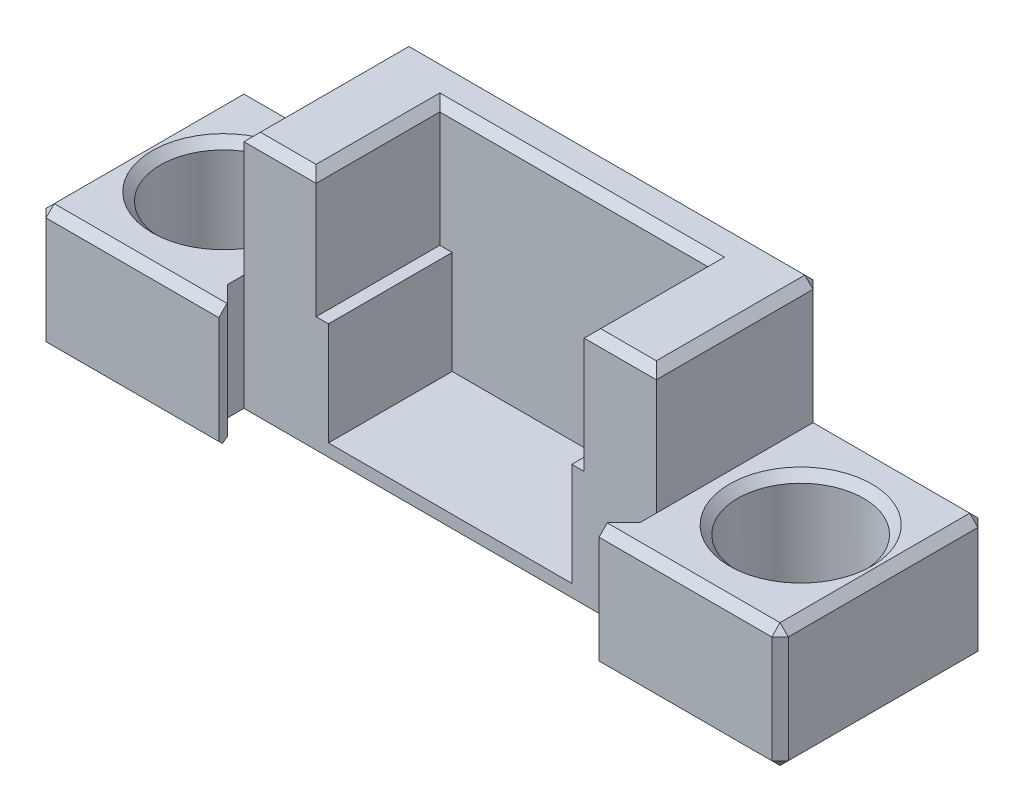
from build123d import *

# Parameters (mm, degrees)
SKETCH1_W           = 20
SKETCH1_H           = 10
BOSS_EXTRUDE1_DEPTH = 12
SKETCH2_W           = 36
SKETCH2_H           = 10
BOSS_EXTRUDE2_DEPTH = 6
SKETCH3_R           = 3.05
CUT_EXTRUDE1_DEPTH  = 20.62141687
SKETCH4_W           = 13
SKETCH4_H           = 6
CUT_EXTRUDE2_DEPTH  = 6
SKETCH5_W           = 20
SKETCH5_H           = 12
CUT_EXTRUDE3_DEPTH  = 2
SKETCH6_W           = 11.8
SKETCH6_H           = 6
CUT_EXTRUDE4_DEPTH  = 5
BOSS_EXTRUDE3_DEPTH = 6


with BuildPart() as part:
    # Sketch1 → Boss-Extrude1 (new body)
    with BuildSketch(Plane(origin=(0, 0, 0), x_dir=(1, 0, 0), z_dir=(0, 1, 0))):
        Rectangle(SKETCH1_W, SKETCH1_H)
    extrude(amount=BOSS_EXTRUDE1_DEPTH)

    # Sketch2 → Boss-Extrude2 (add)
    with BuildSketch(Plane.XZ):
        Rectangle(SKETCH2_W, SKETCH2_H)
    extrude(amount=-BOSS_EXTRUDE2_DEPTH)

    # Sketch3 → Cut-Extrude1 (cut, through all)
    with BuildSketch(Plane(origin=(0, 6, 0), x_dir=(1, 0, 0), z_dir=(0, 1, 0))):
        with Locations(Location((-14, 0, 0), (0, 0, 270))):
            Circle(SKETCH3_R)
        with Locations(Location((14, 0, 0), (0, 0, 270))):
            Circle(SKETCH3_R)
    extrude(amount=-CUT_EXTRUDE1_DEPTH, mode=Mode.SUBTRACT)

    # Sketch4 → Cut-Extrude2 (cut)
    with BuildSketch(Plane(origin=(0, 12, 0), x_dir=(1, 0, 0), z_dir=(0, 1, 0))):
        Rectangle(SKETCH4_W, SKETCH4_H)
    extrude(amount=-CUT_EXTRUDE2_DEPTH, mode=Mode.SUBTRACT)

    # Sketch5 → Cut-Extrude3 (cut)
    with BuildSketch(Plane.XY.offset(5)):
        with Locations((0, 6)):
            Rectangle(SKETCH5_W, SKETCH5_H)
    extrude(amount=-CUT_EXTRUDE3_DEPTH, mode=Mode.SUBTRACT)

    # Sketch6 → Cut-Extrude4 (cut)
    with BuildSketch(Plane(origin=(0, 6, 0), x_dir=(1, 0, 0), z_dir=(0, 1, 0))):
        Rectangle(SKETCH6_W, SKETCH6_H)
    extrude(amount=-CUT_EXTRUDE4_DEPTH, mode=Mode.SUBTRACT)

    # Sketch7 → Boss-Extrude3 (add)
    with BuildSketch(Plane(origin=(0, 6, 0), x_dir=(1, 0, 0), z_dir=(0, 1, 0))):
        Polygon((-10, -5), (-9.22, -5), (-9.22, -4.58), (-10, -3.8), align=None)
        Polygon((10, -3.8), (10, -5), (9.22, -5), (9.22, -4.58), align=None)
    extrude(amount=-BOSS_EXTRUDE3_DEPTH)

    # Chamfer1
    # the kernel refuses this chamfer: 0.4 mm, written as the material it takes off along each edge
    with BuildSketch(Plane(origin=(17.733333333, 5.733333333, 4.733333333), x_dir=(0.7071067811865491, 0, -0.7071067811865459), z_dir=(0.5773502691896257, 0.5773502691896232, 0.5773502691896283)), Plane(origin=(17.733333333, 5.733333333, -4.733333333), x_dir=(-0.7071067811865444, 0, -0.7071067811865506), z_dir=(0.5773502691896283, 0.5773502691896257, -0.5773502691896232)), Plane(origin=(-17.733333333, 0.266666667, 4.733333333), x_dir=(-0.707106781186546, 0, -0.7071067811865491), z_dir=(-0.5773502691896272, -0.5773502691896252, 0.5773502691896248))) as chamfer1_piece_1:
        Polygon((-0.282842712, -0.163299316), (0.282842712, -0.163299316), (0, 0.326598632), align=None)
    extrude(amount=0.508068237, mode=Mode.SUBTRACT)
    with BuildSketch(Plane(origin=(17.733333333, 0.266666667, 4.733333333), x_dir=(-6.2803698347350965e-15, 0.7071067811865472, 0.7071067811865478), z_dir=(0.5773502691896255, -0.5773502691896235, 0.5773502691896282)), Plane(origin=(17.733333333, 0.266666667, -4.733333333), x_dir=(0.7071067811865462, 0.7071067811865488, 0), z_dir=(0.5773502691896282, -0.5773502691896261, -0.5773502691896231)), Plane(origin=(-17.733333333, 0.266666667, -4.733333333), x_dir=(0.7071067811865462, -0.7071067811865488, 0), z_dir=(-0.5773502691896264, -0.5773502691896244, -0.5773502691896264)), Plane(origin=(-17.733333333, 5.733333333, 4.733333333), x_dir=(0, -0.7071067811865475, 0.7071067811865475), z_dir=(-0.5773502691896275, 0.577350269189625, 0.577350269189625)), Plane(origin=(-17.733333333, 5.733333333, -4.733333333), x_dir=(-0.707106781186546, -0.7071067811865491, 0), z_dir=(-0.5773502691896266, 0.577350269189624, -0.5773502691896266)), Plane(origin=(-9.733333333, 11.733333333, -4.733333333), x_dir=(-0.7071067811865475, -0.7071067811865475, 0), z_dir=(-0.577350269189625, 0.577350269189625, -0.5773502691896275)), Plane(origin=(9.733333333, 11.733333333, -4.733333333), x_dir=(0, -0.7071067811865475, -0.7071067811865475), z_dir=(0.5773502691896257, 0.5773502691896257, -0.5773502691896257))) as chamfer1_piece_2:
        Polygon((-0.282842712, 0.163299316), (0.282842712, 0.163299316), (0, -0.326598632), align=None)
    extrude(amount=0.508068237, mode=Mode.SUBTRACT)
    with BuildSketch(Plane(origin=(14, 0, 0), x_dir=(0, 0, 1), z_dir=(-1, 0, 0))) as chamfer1_piece_3:
        with BuildLine():
            Line((3.038686292, 0.411313708), (3.461313708, -0.011313708))
            Line((3.461313708, -0.011313708), (3.461313708, -0.019313708))
            ThreePointArc((3.461313708, -0.019313708), (3.255656854, -0.008), (3.05, -0.008))
            Line((3.05, -0.008), (3.042, 0))
            ThreePointArc((3.042, 0), (3.042, 0.205656854), (3.030686292, 0.411313708))
            Line((3.030686292, 0.411313708), (3.038686292, 0.411313708))
        make_face()
    revolve(axis=Axis((14, 0, 0), (0, 1, 0)), mode=Mode.SUBTRACT)
    with BuildSketch(Plane(origin=(14, 6, 0), x_dir=(0, 0, 1), z_dir=(-1, 0, 0))) as chamfer1_piece_4:
        with BuildLine():
            Line((3.461313708, 0.011313708), (3.038686292, -0.411313708))
            Line((3.038686292, -0.411313708), (3.030686292, -0.411313708))
            ThreePointArc((3.030686292, -0.411313708), (3.042, -0.205656854), (3.042, 0))
            Line((3.042, 0), (3.05, 0.008))
            ThreePointArc((3.05, 0.008), (3.255656854, 0.008), (3.461313708, 0.019313708))
            Line((3.461313708, 0.019313708), (3.461313708, 0.011313708))
        make_face()
    revolve(axis=Axis((14, 6, 0), (0, 1, 0)), mode=Mode.SUBTRACT)
    with BuildSketch(Plane(origin=(-14, 0, 0), x_dir=(0, 0, 1), z_dir=(-1, 0, 0))) as chamfer1_piece_5:
        with BuildLine():
            Line((3.038686292, 0.411313708), (3.461313708, -0.011313708))
            Line((3.461313708, -0.011313708), (3.461313708, -0.019313708))
            ThreePointArc((3.461313708, -0.019313708), (3.255656854, -0.008), (3.05, -0.008))
            Line((3.05, -0.008), (3.042, 0))
            ThreePointArc((3.042, 0), (3.042, 0.205656854), (3.030686292, 0.411313708))
            Line((3.030686292, 0.411313708), (3.038686292, 0.411313708))
        make_face()
    revolve(axis=Axis((-14, 0, 0), (0, 1, 0)), mode=Mode.SUBTRACT)
    with BuildSketch(Plane(origin=(-14, 6, 0), x_dir=(0, 0, 1), z_dir=(-1, 0, 0))) as chamfer1_piece_6:
        with BuildLine():
            Line((3.461313708, 0.011313708), (3.038686292, -0.411313708))
            Line((3.038686292, -0.411313708), (3.030686292, -0.411313708))
            ThreePointArc((3.030686292, -0.411313708), (3.042, -0.205656854), (3.042, 0))
            Line((3.042, 0), (3.05, 0.008))
            ThreePointArc((3.05, 0.008), (3.255656854, 0.008), (3.461313708, 0.019313708))
            Line((3.461313708, 0.019313708), (3.461313708, 0.011313708))
        make_face()
    revolve(axis=Axis((-14, 6, 0), (0, 1, 0)), mode=Mode.SUBTRACT)
    with BuildSketch(Plane(origin=(10, 0, 3), x_dir=(0, 0.9996219169112968, 0.02749587661058625), z_dir=(-1, 0, 0))) as chamfer1_piece_7:
        with BuildLine():
            Line((0.411469278, 0), (-0.022618862, 0.410847117))
            Line((-0.022618862, 0.410847117), (-0.030615837, 0.41062715))
            ThreePointArc((-0.030615837, 0.41062715), (-0.013651691, 0.205359132), (-0.007996975, -0.000219967))
            Line((-0.007996975, -0.000219967), (0.000219967, -0.007996975))
            ThreePointArc((0.000219967, -0.007996975), (0.205799066, -0.00234226), (0.411689245, -0.007996975))
            Line((0.411689245, -0.007996975), (0.411469278, 0))
        make_face()
    extrude(amount=20, mode=Mode.SUBTRACT)
    with BuildSketch(Plane(origin=(10, 0, 4.828673195), x_dir=(-0.027495876610587326, 0.9996219169112966, 0), z_dir=(0, 0, -1))) as chamfer1_piece_8_section:
        with BuildLine():
            Line((0.411469278, 0), (-0.022618862, 0.410847117))
            Line((-0.022618862, 0.410847117), (-0.030615837, 0.41062715))
            ThreePointArc((-0.030615837, 0.41062715), (-0.013651691, 0.205359132), (-0.007996975, -0.000219967))
            Line((-0.007996975, -0.000219967), (0.000219967, -0.007996975))
            ThreePointArc((0.000219967, -0.007996975), (0.205799066, -0.00234226), (0.411689245, -0.007996975))
            Line((0.411689245, -0.007996975), (0.411469278, 0))
        make_face()
    chamfer1_piece_8 = extrude(amount=1.828673195, mode=Mode.PRIVATE)
    chamfer1_piece_8 = split(chamfer1_piece_8, bisect_by=Plane(origin=(10.287531855, 0.140047879, 3.512468145), z_dir=(-0.7071067811865437, 0, -0.7071067811865513)), keep=Keep.TOP, mode=Mode.PRIVATE)
    add(chamfer1_piece_8, mode=Mode.SUBTRACT)
    with BuildSketch(Plane(origin=(8.492618208, 0, 5.307381792), x_dir=(-0.019442520806013025, 0.9996219169112968, -0.019442520806013233), z_dir=(0.7071067811865513, 0, -0.7071067811865437))) as chamfer1_piece_9_section:
        with BuildLine():
            Line((0.411469278, 0), (-0.022618862, 0.410847117))
            Line((-0.022618862, 0.410847117), (-0.030615837, 0.41062715))
            ThreePointArc((-0.030615837, 0.41062715), (-0.013651691, 0.205359132), (-0.007996975, -0.000219967))
            Line((-0.007996975, -0.000219967), (0.000219967, -0.007996975))
            ThreePointArc((0.000219967, -0.007996975), (0.205799066, -0.00234226), (0.411689245, -0.007996975))
            Line((0.411689245, -0.007996975), (0.411469278, 0))
        make_face()
    chamfer1_piece_9 = extrude(amount=3.160432969, mode=Mode.PRIVATE)
    chamfer1_piece_9 = split(chamfer1_piece_9, bisect_by=Plane(origin=(10, 0.134633563, 4.688221688), z_dir=(-1, 0, 0)), keep=Keep.TOP, mode=Mode.PRIVATE)
    add(chamfer1_piece_9, mode=Mode.SUBTRACT)
    with BuildSketch(Plane(origin=(19.028673195, 6, 5), x_dir=(0, 0.027495876610587302, -0.9996219169112966), z_dir=(-1, 0, 0)), Plane(origin=(19.028673195, 0, 5), x_dir=(0, 0.9996219169112966, 0.02749587661058735), z_dir=(-1, 0, 0))) as chamfer1_piece_10:
        with BuildLine():
            Line((0.411469278, 0), (-0.022618862, 0.410847117))
            Line((-0.022618862, 0.410847117), (-0.030615837, 0.41062715))
            ThreePointArc((-0.030615837, 0.41062715), (-0.013651691, 0.205359132), (-0.007996975, -0.000219967))
            Line((-0.007996975, -0.000219967), (0.000219967, -0.007996975))
            ThreePointArc((0.000219967, -0.007996975), (0.205799066, -0.00234226), (0.411689245, -0.007996975))
            Line((0.411689245, -0.007996975), (0.411469278, 0))
        make_face()
    extrude(amount=10.83734639, mode=Mode.SUBTRACT)
    with BuildSketch(Plane(origin=(18, 0, -6.028673195), x_dir=(0.02749587661058735, 0.9996219169112966, 0), z_dir=(0, 0, 1)), Plane(origin=(18, 6, -6.028673195), x_dir=(-0.9996219169112966, 0.02749587661058742, 0), z_dir=(0, 0, 1)), Plane(origin=(-18, 0, 6.028673195), x_dir=(-0.02749587661058735, 0.9996219169112966, 0), z_dir=(0, 0, -1)), Plane(origin=(-18, 6, 6.028673195), x_dir=(0.9996219169112966, 0.02749587661058742, 0), z_dir=(0, 0, -1))) as chamfer1_piece_11:
        with BuildLine():
            Line((0.411469278, 0), (-0.022618862, 0.410847117))
            Line((-0.022618862, 0.410847117), (-0.030615837, 0.41062715))
            ThreePointArc((-0.030615837, 0.41062715), (-0.013651691, 0.205359132), (-0.007996975, -0.000219967))
            Line((-0.007996975, -0.000219967), (0.000219967, -0.007996975))
            ThreePointArc((0.000219967, -0.007996975), (0.205799066, -0.00234226), (0.411689245, -0.007996975))
            Line((0.411689245, -0.007996975), (0.411469278, 0))
        make_face()
    extrude(amount=12.05734639, mode=Mode.SUBTRACT)
    with BuildSketch(Plane(origin=(-19.028673195, 0, -5), x_dir=(0, 0.9996219169112966, -0.02749587661058735), z_dir=(1, 0, 0))) as chamfer1_piece_12:
        with BuildLine():
            Line((0.411469278, 0), (-0.022618862, 0.410847117))
            Line((-0.022618862, 0.410847117), (-0.030615837, 0.41062715))
            ThreePointArc((-0.030615837, 0.41062715), (-0.013651691, 0.205359132), (-0.007996975, -0.000219967))
            Line((-0.007996975, -0.000219967), (0.000219967, -0.007996975))
            ThreePointArc((0.000219967, -0.007996975), (0.205799066, -0.00234226), (0.411689245, -0.007996975))
            Line((0.411689245, -0.007996975), (0.411469278, 0))
        make_face()
    extrude(amount=38.05734639, mode=Mode.SUBTRACT)
    with BuildSketch(Plane(origin=(-19.028673195, 0, 5), x_dir=(0, 0.9996219169112966, 0.02749587661058735), z_dir=(1, 0, 0)), Plane(origin=(-8.191326805, 6, 5), x_dir=(0, -0.9996219169112966, 0.027495876610587302), z_dir=(-1, 0, 0))) as chamfer1_piece_13:
        with BuildLine():
            Line((0.411469278, 0), (-0.022618862, -0.410847117))
            Line((-0.022618862, -0.410847117), (-0.030615837, -0.41062715))
            ThreePointArc((-0.030615837, -0.41062715), (-0.013651691, -0.205359132), (-0.007996975, 0.000219967))
            Line((-0.007996975, 0.000219967), (0.000219967, 0.007996975))
            ThreePointArc((0.000219967, 0.007996975), (0.205799066, 0.00234226), (0.411689245, 0.007996975))
            Line((0.411689245, 0.007996975), (0.411469278, 0))
        make_face()
    extrude(amount=10.83734639, mode=Mode.SUBTRACT)
    with BuildSketch(Plane(origin=(-8.492618208, 0, 5.307381792), x_dir=(0.019442520806011977, 0.9996219169112968, -0.019442520806012123), z_dir=(-0.7071067811865501, 0, -0.7071067811865449))) as chamfer1_piece_14_section:
        with BuildLine():
            Line((0.411469278, 0), (-0.022618862, -0.410847117))
            Line((-0.022618862, -0.410847117), (-0.030615837, -0.41062715))
            ThreePointArc((-0.030615837, -0.41062715), (-0.013651691, -0.205359132), (-0.007996975, 0.000219967))
            Line((-0.007996975, 0.000219967), (0.000219967, 0.007996975))
            ThreePointArc((0.000219967, 0.007996975), (0.205799066, 0.00234226), (0.411689245, 0.007996975))
            Line((0.411689245, 0.007996975), (0.411469278, 0))
        make_face()
    chamfer1_piece_14 = extrude(amount=3.160432969, mode=Mode.PRIVATE)
    chamfer1_piece_14 = split(chamfer1_piece_14, bisect_by=Plane(origin=(-10, 0.134633563, 4.688221688), z_dir=(1, 0, 0)), keep=Keep.TOP, mode=Mode.PRIVATE)
    add(chamfer1_piece_14, mode=Mode.SUBTRACT)
    with BuildSketch(Plane(origin=(-10, 0, 4.828673195), x_dir=(0.02749587661058735, 0.9996219169112966, 0), z_dir=(0, 0, -1))) as chamfer1_piece_15_section:
        with BuildLine():
            Line((0.411469278, 0), (-0.022618862, -0.410847117))
            Line((-0.022618862, -0.410847117), (-0.030615837, -0.41062715))
            ThreePointArc((-0.030615837, -0.41062715), (-0.013651691, -0.205359132), (-0.007996975, 0.000219967))
            Line((-0.007996975, 0.000219967), (0.000219967, 0.007996975))
            ThreePointArc((0.000219967, 0.007996975), (0.205799066, 0.00234226), (0.411689245, 0.007996975))
            Line((0.411689245, 0.007996975), (0.411469278, 0))
        make_face()
    chamfer1_piece_15 = extrude(amount=1.828673195, mode=Mode.PRIVATE)
    chamfer1_piece_15 = split(chamfer1_piece_15, bisect_by=Plane(origin=(-10.287531855, 0.140047879, 3.512468145), z_dir=(0.7071067811865449, 0, -0.7071067811865501)), keep=Keep.TOP, mode=Mode.PRIVATE)
    add(chamfer1_piece_15, mode=Mode.SUBTRACT)
    with BuildSketch(Plane(origin=(6.5, 12, 4.028673195), x_dir=(-0.027495876610587302, -0.9996219169112966, 0), z_dir=(0, 0, -1)), Plane(origin=(-6.5, 12, -3), x_dir=(0.027495876610587302, -0.9996219169112966, 0), z_dir=(0, 0, 1))) as chamfer1_piece_16:
        with BuildLine():
            Line((0.411469278, 0), (-0.022618862, -0.410847117))
            Line((-0.022618862, -0.410847117), (-0.030615837, -0.41062715))
            ThreePointArc((-0.030615837, -0.41062715), (-0.013651691, -0.205359132), (-0.007996975, 0.000219967))
            Line((-0.007996975, 0.000219967), (0.000219967, 0.007996975))
            ThreePointArc((0.000219967, 0.007996975), (0.205799066, 0.00234226), (0.411689245, 0.007996975))
            Line((0.411689245, 0.007996975), (0.411469278, 0))
        make_face()
    extrude(amount=7.028673195, mode=Mode.SUBTRACT)
    with BuildSketch(Plane(origin=(6.5, 12, -3), x_dir=(0, -0.9996219169112968, 0.027495876610586226), z_dir=(-1, 0, 0))) as chamfer1_piece_17:
        with BuildLine():
            Line((0.411469278, 0), (-0.022618862, -0.410847117))
            Line((-0.022618862, -0.410847117), (-0.030615837, -0.41062715))
            ThreePointArc((-0.030615837, -0.41062715), (-0.013651691, -0.205359132), (-0.007996975, 0.000219967))
            Line((-0.007996975, 0.000219967), (0.000219967, 0.007996975))
            ThreePointArc((0.000219967, 0.007996975), (0.205799066, 0.00234226), (0.411689245, 0.007996975))
            Line((0.411689245, 0.007996975), (0.411469278, 0))
        make_face()
    extrude(amount=13, mode=Mode.SUBTRACT)
    with BuildSketch(Plane(origin=(-11.028673195, 12, 3), x_dir=(0, -0.9996219169112968, 0.027495876610586226), z_dir=(1, 0, 0)), Plane(origin=(5.471326805, 12, 3), x_dir=(0, -0.9996219169112968, 0.027495876610586226), z_dir=(1, 0, 0))) as chamfer1_piece_18:
        with BuildLine():
            Line((0.411469278, 0), (-0.022618862, 0.410847117))
            Line((-0.022618862, 0.410847117), (-0.030615837, 0.41062715))
            ThreePointArc((-0.030615837, 0.41062715), (-0.013651691, 0.205359132), (-0.007996975, -0.000219967))
            Line((-0.007996975, -0.000219967), (0.000219967, -0.007996975))
            ThreePointArc((0.000219967, -0.007996975), (0.205799066, -0.00234226), (0.411689245, -0.007996975))
            Line((0.411689245, -0.007996975), (0.411469278, 0))
        make_face()
    extrude(amount=5.55734639, mode=Mode.SUBTRACT)
    with BuildSketch(Plane(origin=(-10, 12, -6.028673195), x_dir=(-0.027495876610587302, -0.9996219169112966, 0), z_dir=(0, 0, 1))) as chamfer1_piece_19:
        with BuildLine():
            Line((0.411469278, 0), (-0.022618862, 0.410847117))
            Line((-0.022618862, 0.410847117), (-0.030615837, 0.41062715))
            ThreePointArc((-0.030615837, 0.41062715), (-0.013651691, 0.205359132), (-0.007996975, -0.000219967))
            Line((-0.007996975, -0.000219967), (0.000219967, -0.007996975))
            ThreePointArc((0.000219967, -0.007996975), (0.205799066, -0.00234226), (0.411689245, -0.007996975))
            Line((0.411689245, -0.007996975), (0.411469278, 0))
        make_face()
    extrude(amount=10.05734639, mode=Mode.SUBTRACT)
    with BuildSketch(Plane(origin=(11.028673195, 12, -5), x_dir=(0, -0.9996219169112966, -0.027495876610587302), z_dir=(-1, 0, 0))) as chamfer1_piece_20:
        with BuildLine():
            Line((0.411469278, 0), (-0.022618862, 0.410847117))
            Line((-0.022618862, 0.410847117), (-0.030615837, 0.41062715))
            ThreePointArc((-0.030615837, 0.41062715), (-0.013651691, 0.205359132), (-0.007996975, -0.000219967))
            Line((-0.007996975, -0.000219967), (0.000219967, -0.007996975))
            ThreePointArc((0.000219967, -0.007996975), (0.205799066, -0.00234226), (0.411689245, -0.007996975))
            Line((0.411689245, -0.007996975), (0.411469278, 0))
        make_face()
    extrude(amount=22.05734639, mode=Mode.SUBTRACT)
    with BuildSketch(Plane(origin=(10, 12, 4.028673195), x_dir=(-0.9996219169112966, 0.027495876610587302, 0), z_dir=(0, 0, -1))) as chamfer1_piece_21:
        with BuildLine():
            Line((0.411469278, 0), (-0.022618862, -0.410847117))
            Line((-0.022618862, -0.410847117), (-0.030615837, -0.41062715))
            ThreePointArc((-0.030615837, -0.41062715), (-0.013651691, -0.205359132), (-0.007996975, 0.000219967))
            Line((-0.007996975, 0.000219967), (0.000219967, 0.007996975))
            ThreePointArc((0.000219967, 0.007996975), (0.205799066, 0.00234226), (0.411689245, 0.007996975))
            Line((0.411689245, 0.007996975), (0.411469278, 0))
        make_face()
    extrude(amount=10.05734639, mode=Mode.SUBTRACT)
    with BuildSketch(Plane(origin=(10, 6, -5), x_dir=(-0.9996219169112966, 0, -0.027495876610587302), z_dir=(0, 1, 0)), Plane(origin=(-10, 6, -5), x_dir=(-0.027495876610587302, 0, 0.9996219169112966), z_dir=(0, 1, 0))) as chamfer1_piece_22:
        with BuildLine():
            Line((0.411469278, 0), (-0.022618862, 0.410847117))
            Line((-0.022618862, 0.410847117), (-0.030615837, 0.41062715))
            ThreePointArc((-0.030615837, 0.41062715), (-0.013651691, 0.205359132), (-0.007996975, -0.000219967))
            Line((-0.007996975, -0.000219967), (0.000219967, -0.007996975))
            ThreePointArc((0.000219967, -0.007996975), (0.205799066, -0.00234226), (0.411689245, -0.007996975))
            Line((0.411689245, -0.007996975), (0.411469278, 0))
        make_face()
    extrude(amount=7.028673195, mode=Mode.SUBTRACT)
    with BuildSketch(Plane(origin=(10, 6, -5), x_dir=(0, -0.9996219169112966, -0.027495876610591618), z_dir=(1, 0, 0)), Plane(origin=(-19.028673195, 6, -5), x_dir=(0, -0.9996219169112966, -0.027495876610587302), z_dir=(1, 0, 0))) as chamfer1_piece_23:
        with BuildLine():
            Line((0.411469278, 0), (-0.022618862, -0.410847117))
            Line((-0.022618862, -0.410847117), (-0.030615837, -0.41062715))
            ThreePointArc((-0.030615837, -0.41062715), (-0.013651691, -0.205359132), (-0.007996975, 0.000219967))
            Line((-0.007996975, 0.000219967), (0.000219967, 0.007996975))
            ThreePointArc((0.000219967, 0.007996975), (0.205799066, 0.00234226), (0.411689245, 0.007996975))
            Line((0.411689245, 0.007996975), (0.411469278, 0))
        make_face()
    extrude(amount=9.028673195, mode=Mode.SUBTRACT)
    with BuildSketch(Plane(origin=(18, -1.028673195, 5), x_dir=(-0.9996219169112966, 0, 0.02749587661058742), z_dir=(0, 1, 0)), Plane(origin=(-18, -1.028673195, -5), x_dir=(0.9996219169112966, 0, -0.02749587661058742), z_dir=(0, 1, 0))) as chamfer1_piece_24:
        with BuildLine():
            Line((0.411469278, 0), (-0.022618862, -0.410847117))
            Line((-0.022618862, -0.410847117), (-0.030615837, -0.41062715))
            ThreePointArc((-0.030615837, -0.41062715), (-0.013651691, -0.205359132), (-0.007996975, 0.000219967))
            Line((-0.007996975, 0.000219967), (0.000219967, 0.007996975))
            ThreePointArc((0.000219967, 0.007996975), (0.205799066, 0.00234226), (0.411689245, 0.007996975))
            Line((0.411689245, 0.007996975), (0.411469278, 0))
        make_face()
    extrude(amount=8.05734639, mode=Mode.SUBTRACT)
    with BuildSketch(Plane(origin=(18, -1.028673195, -5), x_dir=(-0.9996219169112966, 0, -0.02749587661058742), z_dir=(0, 1, 0)), Plane(origin=(-18, -1.028673195, 5), x_dir=(0.9996219169112966, 0, 0.02749587661058742), z_dir=(0, 1, 0))) as chamfer1_piece_25:
        with BuildLine():
            Line((0.411469278, 0), (-0.022618862, 0.410847117))
            Line((-0.022618862, 0.410847117), (-0.030615837, 0.41062715))
            ThreePointArc((-0.030615837, 0.41062715), (-0.013651691, 0.205359132), (-0.007996975, -0.000219967))
            Line((-0.007996975, -0.000219967), (0.000219967, -0.007996975))
            ThreePointArc((0.000219967, -0.007996975), (0.205799066, -0.00234226), (0.411689245, -0.007996975))
            Line((0.411689245, -0.007996975), (0.411469278, 0))
        make_face()
    extrude(amount=8.05734639, mode=Mode.SUBTRACT)
    with BuildSketch(Plane(origin=(11.028673195, 0, 3), x_dir=(0, 0.9996219169112968, 0.02749587661058625), z_dir=(-1, 0, 0))) as chamfer1_piece_26a_section:
        with BuildLine():
            Line((0.411469278, 0), (-0.022618862, 0.410847117))
            Line((-0.022618862, 0.410847117), (-0.030615837, 0.41062715))
            ThreePointArc((-0.030615837, 0.41062715), (-0.013651691, 0.205359132), (-0.007996975, -0.000219967))
            Line((-0.007996975, -0.000219967), (0.000219967, -0.007996975))
            ThreePointArc((0.000219967, -0.007996975), (0.205799066, -0.00234226), (0.411689245, -0.007996975))
            Line((0.411689245, -0.007996975), (0.411469278, 0))
        make_face()
    chamfer1_piece_26a = extrude(amount=21.028673195, mode=Mode.PRIVATE)
    chamfer1_piece_26a = split(chamfer1_piece_26a, bisect_by=Plane(origin=(10, 0.131917451, 2.868082549), z_dir=(1, 0, 0)), keep=Keep.TOP, mode=Mode.PRIVATE)
    with BuildSketch(Plane(origin=(10, 0, 4.828673195), x_dir=(-0.027495876610587326, 0.9996219169112966, 0), z_dir=(0, 0, -1))) as chamfer1_piece_26b_section:
        with BuildLine():
            Line((0.411469278, 0), (-0.022618862, 0.410847117))
            Line((-0.022618862, 0.410847117), (-0.030615837, 0.41062715))
            ThreePointArc((-0.030615837, 0.41062715), (-0.013651691, 0.205359132), (-0.007996975, -0.000219967))
            Line((-0.007996975, -0.000219967), (0.000219967, -0.007996975))
            ThreePointArc((0.000219967, -0.007996975), (0.205799066, -0.00234226), (0.411689245, -0.007996975))
            Line((0.411689245, -0.007996975), (0.411469278, 0))
        make_face()
    chamfer1_piece_26b = extrude(amount=2.85734639, mode=Mode.PRIVATE)
    chamfer1_piece_26b = split(chamfer1_piece_26b, bisect_by=Plane(origin=(10.131917451, 0.131917451, 3), z_dir=(0, 0, -1)), keep=Keep.TOP, mode=Mode.PRIVATE)
    chamfer1_piece_26 = chamfer1_piece_26a & chamfer1_piece_26b
    add(chamfer1_piece_26, mode=Mode.SUBTRACT)
    with BuildSketch(Plane(origin=(-10, 0, 4.828673195), x_dir=(0.02749587661058735, 0.9996219169112966, 0), z_dir=(0, 0, -1))) as chamfer1_piece_27a_section:
        with BuildLine():
            Line((0.411469278, 0), (-0.022618862, -0.410847117))
            Line((-0.022618862, -0.410847117), (-0.030615837, -0.41062715))
            ThreePointArc((-0.030615837, -0.41062715), (-0.013651691, -0.205359132), (-0.007996975, 0.000219967))
            Line((-0.007996975, 0.000219967), (0.000219967, 0.007996975))
            ThreePointArc((0.000219967, 0.007996975), (0.205799066, 0.00234226), (0.411689245, 0.007996975))
            Line((0.411689245, 0.007996975), (0.411469278, 0))
        make_face()
    chamfer1_piece_27a = extrude(amount=2.85734639, mode=Mode.PRIVATE)
    chamfer1_piece_27a = split(chamfer1_piece_27a, bisect_by=Plane(origin=(-10.131917451, 0.131917451, 3), z_dir=(0, 0, -1)), keep=Keep.TOP, mode=Mode.PRIVATE)
    with BuildSketch(Plane(origin=(10, 0, 3), x_dir=(0, 0.9996219169112968, 0.02749587661058625), z_dir=(-1, 0, 0))) as chamfer1_piece_27b_section:
        with BuildLine():
            Line((0.411469278, 0), (-0.022618862, 0.410847117))
            Line((-0.022618862, 0.410847117), (-0.030615837, 0.41062715))
            ThreePointArc((-0.030615837, 0.41062715), (-0.013651691, 0.205359132), (-0.007996975, -0.000219967))
            Line((-0.007996975, -0.000219967), (0.000219967, -0.007996975))
            ThreePointArc((0.000219967, -0.007996975), (0.205799066, -0.00234226), (0.411689245, -0.007996975))
            Line((0.411689245, -0.007996975), (0.411469278, 0))
        make_face()
    chamfer1_piece_27b = extrude(amount=21.028673195, mode=Mode.PRIVATE)
    chamfer1_piece_27b = split(chamfer1_piece_27b, bisect_by=Plane(origin=(-10, 0.131917451, 2.868082549), z_dir=(-1, 0, 0)), keep=Keep.TOP, mode=Mode.PRIVATE)
    chamfer1_piece_27 = chamfer1_piece_27a & chamfer1_piece_27b
    add(chamfer1_piece_27, mode=Mode.SUBTRACT)
    with BuildSketch(Plane(origin=(8.492618208, 0, 5.307381792), x_dir=(-0.019442520806013025, 0.9996219169112968, -0.019442520806013233), z_dir=(0.7071067811865513, 0, -0.7071067811865437))) as chamfer1_piece_28a_section:
        with BuildLine():
            Line((0.411469278, 0), (-0.022618862, 0.410847117))
            Line((-0.022618862, 0.410847117), (-0.030615837, 0.41062715))
            ThreePointArc((-0.030615837, 0.41062715), (-0.013651691, 0.205359132), (-0.007996975, -0.000219967))
            Line((-0.007996975, -0.000219967), (0.000219967, -0.007996975))
            ThreePointArc((0.000219967, -0.007996975), (0.205799066, -0.00234226), (0.411689245, -0.007996975))
            Line((0.411689245, -0.007996975), (0.411469278, 0))
        make_face()
    chamfer1_piece_28a = extrude(amount=3.160432969, mode=Mode.PRIVATE)
    chamfer1_piece_28a = split(chamfer1_piece_28a, bisect_by=Plane(origin=(10, 0.12723725, 3.585514254), z_dir=(1, 0, 0)), keep=Keep.TOP, mode=Mode.PRIVATE)
    with BuildSketch(Plane(origin=(10, 0, 4.828673195), x_dir=(-0.027495876610587326, 0.9996219169112966, 0), z_dir=(0, 0, -1))) as chamfer1_piece_28b_section:
        with BuildLine():
            Line((0.411469278, 0), (-0.022618862, 0.410847117))
            Line((-0.022618862, 0.410847117), (-0.030615837, 0.41062715))
            ThreePointArc((-0.030615837, 0.41062715), (-0.013651691, 0.205359132), (-0.007996975, -0.000219967))
            Line((-0.007996975, -0.000219967), (0.000219967, -0.007996975))
            ThreePointArc((0.000219967, -0.007996975), (0.205799066, -0.00234226), (0.411689245, -0.007996975))
            Line((0.411689245, -0.007996975), (0.411469278, 0))
        make_face()
    chamfer1_piece_28b = extrude(amount=1.828673195, mode=Mode.PRIVATE)
    chamfer1_piece_28b = split(chamfer1_piece_28b, bisect_by=Plane(origin=(9.848335675, 0.12723725, 3.951664325), z_dir=(0.7071067811865437, 0, 0.7071067811865513)), keep=Keep.TOP, mode=Mode.PRIVATE)
    chamfer1_piece_28 = chamfer1_piece_28a & chamfer1_piece_28b
    add(chamfer1_piece_28, mode=Mode.SUBTRACT)
    with BuildSketch(Plane(origin=(-8.492618208, 0, 5.307381792), x_dir=(0.019442520806011977, 0.9996219169112968, -0.019442520806012123), z_dir=(-0.7071067811865501, 0, -0.7071067811865449))) as chamfer1_piece_29a_section:
        with BuildLine():
            Line((0.411469278, 0), (-0.022618862, -0.410847117))
            Line((-0.022618862, -0.410847117), (-0.030615837, -0.41062715))
            ThreePointArc((-0.030615837, -0.41062715), (-0.013651691, -0.205359132), (-0.007996975, 0.000219967))
            Line((-0.007996975, 0.000219967), (0.000219967, 0.007996975))
            ThreePointArc((0.000219967, 0.007996975), (0.205799066, 0.00234226), (0.411689245, 0.007996975))
            Line((0.411689245, 0.007996975), (0.411469278, 0))
        make_face()
    chamfer1_piece_29a = extrude(amount=3.160432969, mode=Mode.PRIVATE)
    chamfer1_piece_29a = split(chamfer1_piece_29a, bisect_by=Plane(origin=(-10, 0.12723725, 3.585514254), z_dir=(-1, 0, 0)), keep=Keep.TOP, mode=Mode.PRIVATE)
    with BuildSketch(Plane(origin=(-10, 0, 4.828673195), x_dir=(0.02749587661058735, 0.9996219169112966, 0), z_dir=(0, 0, -1))) as chamfer1_piece_29b_section:
        with BuildLine():
            Line((0.411469278, 0), (-0.022618862, -0.410847117))
            Line((-0.022618862, -0.410847117), (-0.030615837, -0.41062715))
            ThreePointArc((-0.030615837, -0.41062715), (-0.013651691, -0.205359132), (-0.007996975, 0.000219967))
            Line((-0.007996975, 0.000219967), (0.000219967, 0.007996975))
            ThreePointArc((0.000219967, 0.007996975), (0.205799066, 0.00234226), (0.411689245, 0.007996975))
            Line((0.411689245, 0.007996975), (0.411469278, 0))
        make_face()
    chamfer1_piece_29b = extrude(amount=1.828673195, mode=Mode.PRIVATE)
    chamfer1_piece_29b = split(chamfer1_piece_29b, bisect_by=Plane(origin=(-9.848335675, 0.12723725, 3.951664325), z_dir=(-0.7071067811865449, 0, 0.7071067811865501)), keep=Keep.TOP, mode=Mode.PRIVATE)
    chamfer1_piece_29 = chamfer1_piece_29a & chamfer1_piece_29b
    add(chamfer1_piece_29, mode=Mode.SUBTRACT)
    with BuildSketch(Plane(origin=(7.528673195, 12, -3), x_dir=(0, -0.9996219169112968, 0.027495876610586226), z_dir=(-1, 0, 0))) as chamfer1_piece_30a_section:
        with BuildLine():
            Line((0.411469278, 0), (-0.022618862, -0.410847117))
            Line((-0.022618862, -0.410847117), (-0.030615837, -0.41062715))
            ThreePointArc((-0.030615837, -0.41062715), (-0.013651691, -0.205359132), (-0.007996975, 0.000219967))
            Line((-0.007996975, 0.000219967), (0.000219967, 0.007996975))
            ThreePointArc((0.000219967, 0.007996975), (0.205799066, 0.00234226), (0.411689245, 0.007996975))
            Line((0.411689245, 0.007996975), (0.411469278, 0))
        make_face()
    chamfer1_piece_30a = extrude(amount=14.028673195, mode=Mode.PRIVATE)
    chamfer1_piece_30a = split(chamfer1_piece_30a, bisect_by=Plane(origin=(6.5, 11.868082549, -3.131917451), z_dir=(1, 0, 0)), keep=Keep.TOP, mode=Mode.PRIVATE)
    with BuildSketch(Plane(origin=(6.5, 12, 4.028673195), x_dir=(-0.027495876610587302, -0.9996219169112966, 0), z_dir=(0, 0, -1))) as chamfer1_piece_30b_section:
        with BuildLine():
            Line((0.411469278, 0), (-0.022618862, -0.410847117))
            Line((-0.022618862, -0.410847117), (-0.030615837, -0.41062715))
            ThreePointArc((-0.030615837, -0.41062715), (-0.013651691, -0.205359132), (-0.007996975, 0.000219967))
            Line((-0.007996975, 0.000219967), (0.000219967, 0.007996975))
            ThreePointArc((0.000219967, 0.007996975), (0.205799066, 0.00234226), (0.411689245, 0.007996975))
            Line((0.411689245, 0.007996975), (0.411469278, 0))
        make_face()
    chamfer1_piece_30b = extrude(amount=8.05734639, mode=Mode.PRIVATE)
    chamfer1_piece_30b = split(chamfer1_piece_30b, bisect_by=Plane(origin=(6.631917451, 11.868082549, -3), z_dir=(0, 0, -1)), keep=Keep.TOP, mode=Mode.PRIVATE)
    chamfer1_piece_30 = chamfer1_piece_30a & chamfer1_piece_30b
    add(chamfer1_piece_30, mode=Mode.SUBTRACT)
    with BuildSketch(Plane(origin=(-6.5, 12, -4.028673195), x_dir=(0.027495876610587302, -0.9996219169112966, 0), z_dir=(0, 0, 1))) as chamfer1_piece_31a_section:
        with BuildLine():
            Line((0.411469278, 0), (-0.022618862, -0.410847117))
            Line((-0.022618862, -0.410847117), (-0.030615837, -0.41062715))
            ThreePointArc((-0.030615837, -0.41062715), (-0.013651691, -0.205359132), (-0.007996975, 0.000219967))
            Line((-0.007996975, 0.000219967), (0.000219967, 0.007996975))
            ThreePointArc((0.000219967, 0.007996975), (0.205799066, 0.00234226), (0.411689245, 0.007996975))
            Line((0.411689245, 0.007996975), (0.411469278, 0))
        make_face()
    chamfer1_piece_31a = extrude(amount=8.05734639, mode=Mode.PRIVATE)
    chamfer1_piece_31a = split(chamfer1_piece_31a, bisect_by=Plane(origin=(-6.631917451, 11.868082549, -3), z_dir=(0, 0, -1)), keep=Keep.TOP, mode=Mode.PRIVATE)
    with BuildSketch(Plane(origin=(6.5, 12, -3), x_dir=(0, -0.9996219169112968, 0.027495876610586226), z_dir=(-1, 0, 0))) as chamfer1_piece_31b_section:
        with BuildLine():
            Line((0.411469278, 0), (-0.022618862, -0.410847117))
            Line((-0.022618862, -0.410847117), (-0.030615837, -0.41062715))
            ThreePointArc((-0.030615837, -0.41062715), (-0.013651691, -0.205359132), (-0.007996975, 0.000219967))
            Line((-0.007996975, 0.000219967), (0.000219967, 0.007996975))
            ThreePointArc((0.000219967, 0.007996975), (0.205799066, 0.00234226), (0.411689245, 0.007996975))
            Line((0.411689245, 0.007996975), (0.411469278, 0))
        make_face()
    chamfer1_piece_31b = extrude(amount=14.028673195, mode=Mode.PRIVATE)
    chamfer1_piece_31b = split(chamfer1_piece_31b, bisect_by=Plane(origin=(-6.5, 11.868082549, -3.131917451), z_dir=(-1, 0, 0)), keep=Keep.TOP, mode=Mode.PRIVATE)
    chamfer1_piece_31 = chamfer1_piece_31a & chamfer1_piece_31b
    add(chamfer1_piece_31, mode=Mode.SUBTRACT)
    with BuildSketch(Plane(origin=(8.971326805, 6, -5), x_dir=(0, -0.9996219169112966, -0.027495876610587302), z_dir=(1, 0, 0))) as chamfer1_piece_32a_section:
        with BuildLine():
            Line((0.411469278, 0), (-0.022618862, -0.410847117))
            Line((-0.022618862, -0.410847117), (-0.030615837, -0.41062715))
            ThreePointArc((-0.030615837, -0.41062715), (-0.013651691, -0.205359132), (-0.007996975, 0.000219967))
            Line((-0.007996975, 0.000219967), (0.000219967, 0.007996975))
            ThreePointArc((0.000219967, 0.007996975), (0.205799066, 0.00234226), (0.411689245, 0.007996975))
            Line((0.411689245, 0.007996975), (0.411469278, 0))
        make_face()
    chamfer1_piece_32a = extrude(amount=10.05734639, mode=Mode.PRIVATE)
    chamfer1_piece_32a = split(chamfer1_piece_32a, bisect_by=Plane(origin=(10, 5.868082549, -4.868082549), z_dir=(-1, 0, 0)), keep=Keep.TOP, mode=Mode.PRIVATE)
    with BuildSketch(Plane(origin=(10, 4.971326805, -5), x_dir=(-0.9996219169112966, 0, -0.027495876610587302), z_dir=(0, 1, 0))) as chamfer1_piece_32b_section:
        with BuildLine():
            Line((0.411469278, 0), (-0.022618862, 0.410847117))
            Line((-0.022618862, 0.410847117), (-0.030615837, 0.41062715))
            ThreePointArc((-0.030615837, 0.41062715), (-0.013651691, 0.205359132), (-0.007996975, -0.000219967))
            Line((-0.007996975, -0.000219967), (0.000219967, -0.007996975))
            ThreePointArc((0.000219967, -0.007996975), (0.205799066, -0.00234226), (0.411689245, -0.007996975))
            Line((0.411689245, -0.007996975), (0.411469278, 0))
        make_face()
    chamfer1_piece_32b = extrude(amount=8.05734639, mode=Mode.PRIVATE)
    chamfer1_piece_32b = split(chamfer1_piece_32b, bisect_by=Plane(origin=(9.868082549, 6, -4.868082549), z_dir=(0, -1, 0)), keep=Keep.TOP, mode=Mode.PRIVATE)
    chamfer1_piece_32 = chamfer1_piece_32a & chamfer1_piece_32b
    add(chamfer1_piece_32, mode=Mode.SUBTRACT)
    with BuildSketch(Plane(origin=(-10, 4.971326805, -5), x_dir=(-0.027495876610587302, 0, 0.9996219169112966), z_dir=(0, 1, 0))) as chamfer1_piece_33a_section:
        with BuildLine():
            Line((0.411469278, 0), (-0.022618862, 0.410847117))
            Line((-0.022618862, 0.410847117), (-0.030615837, 0.41062715))
            ThreePointArc((-0.030615837, 0.41062715), (-0.013651691, 0.205359132), (-0.007996975, -0.000219967))
            Line((-0.007996975, -0.000219967), (0.000219967, -0.007996975))
            ThreePointArc((0.000219967, -0.007996975), (0.205799066, -0.00234226), (0.411689245, -0.007996975))
            Line((0.411689245, -0.007996975), (0.411469278, 0))
        make_face()
    chamfer1_piece_33a = extrude(amount=8.05734639, mode=Mode.PRIVATE)
    chamfer1_piece_33a = split(chamfer1_piece_33a, bisect_by=Plane(origin=(-9.868082549, 6, -4.868082549), z_dir=(0, -1, 0)), keep=Keep.TOP, mode=Mode.PRIVATE)
    with BuildSketch(Plane(origin=(-19.028673195, 6, -5), x_dir=(0, -0.9996219169112966, -0.027495876610587302), z_dir=(1, 0, 0))) as chamfer1_piece_33b_section:
        with BuildLine():
            Line((0.411469278, 0), (-0.022618862, -0.410847117))
            Line((-0.022618862, -0.410847117), (-0.030615837, -0.41062715))
            ThreePointArc((-0.030615837, -0.41062715), (-0.013651691, -0.205359132), (-0.007996975, 0.000219967))
            Line((-0.007996975, 0.000219967), (0.000219967, 0.007996975))
            ThreePointArc((0.000219967, 0.007996975), (0.205799066, 0.00234226), (0.411689245, 0.007996975))
            Line((0.411689245, 0.007996975), (0.411469278, 0))
        make_face()
    chamfer1_piece_33b = extrude(amount=10.05734639, mode=Mode.PRIVATE)
    chamfer1_piece_33b = split(chamfer1_piece_33b, bisect_by=Plane(origin=(-10, 5.868082549, -4.868082549), z_dir=(1, 0, 0)), keep=Keep.TOP, mode=Mode.PRIVATE)
    chamfer1_piece_33 = chamfer1_piece_33a & chamfer1_piece_33b
    add(chamfer1_piece_33, mode=Mode.SUBTRACT)


solid = part.part
